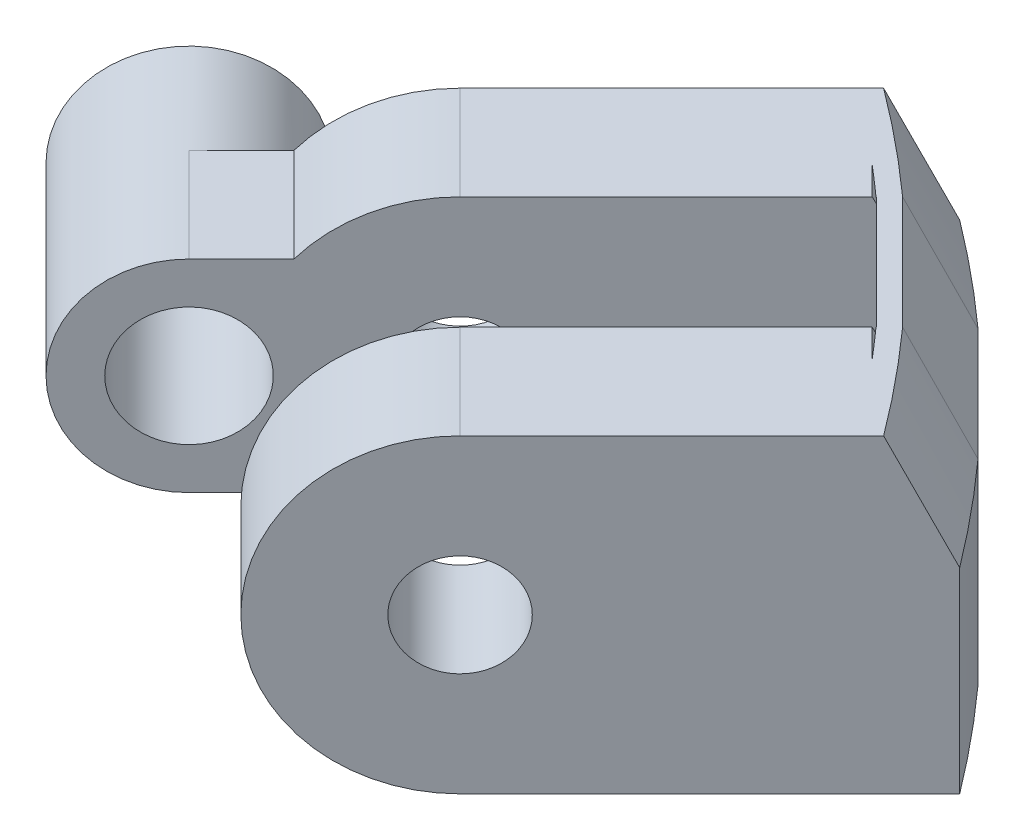
from build123d import *

# Parameters (mm, degrees)
SHELL1_T            = -0.8
SKETCH7_R           = 3
CUT_EXTRUDE3_DEPTH  = 186.253539274
BOSS_EXTRUDE1_DEPTH = 7.5
CUT_EXTRUDE4_DEPTH  = 1.75
CIRPATTERN1_COUNT   = 2
BOSS_EXTRUDE3_DEPTH = 10
CUT_EXTRUDE8_DEPTH  = 65.5
SKETCH17_R          = 0.75
BOSS_EXTRUDE4_DEPTH = 1.25
BOSS_EXTRUDE7_START = -6.25
BOSS_EXTRUDE7_DEPTH = 6.25
CUT_EXTRUDE9_REACH  = 192.044
SKETCH21_R          = 2.8
SKETCH22_R          = 4.75
SKETCH22_R_2        = 2.8
BOSS_EXTRUDE8_DEPTH = 4
SKETCH23_R          = 4.75
SKETCH23_R_2        = 2.3
BOSS_EXTRUDE9_DEPTH = 2
CIRPATTERN4_COUNT   = 4
BOSS_EXTRUDE6_REACH = 190.07
CIRPATTERN8_COUNT   = 4
CUT_EXTRUDE10_DEPTH = 172.733380907
CUT_EXTRUDE11_DEPTH = 120.808386396
CUT_EXTRUDE12_DEPTH = 96.01307774


with BuildPart() as part:
    # Sketch3 → Revolve1 (revolve)
    with BuildSketch(Plane.XY):
        with BuildLine():
            Line((0, 0), (0, 155.681963674))
            ThreePointArc((0, 155.681963674), (2.236067977, 155.154099629), (4, 153.681963674))
            Line((4, 153.681963674), (71, 10))
            Line((71, 10), (71, 0))
            Line((71, 0), (67.5, 0))
            Line((67.5, 0), (67.5, -50))
            Line((67.5, -50), (0, -50))
            Line((0, -50), (0, 0))
        make_face()
    revolve(axis=Axis((0, 0, 0), (0, 1, 0)))

    # Shell1
    shell1_openings = [part.faces().sort_by_distance(p)[0] for p in [
        (0, -50, 0),
    ]]
    offset(amount=SHELL1_T, openings=shell1_openings, kind=Kind.INTERSECTION)

    # Sketch7 → Cut-Extrude3 (cut, through all)
    with BuildSketch(Plane(origin=(0, 0, 0), x_dir=(1, 0, 0), z_dir=(0, 1, 0))):
        Circle(SKETCH7_R)
    extrude(amount=CUT_EXTRUDE3_DEPTH, mode=Mode.SUBTRACT)

    # Sketch8 → Boss-Extrude1 (add, symmetric)
    with BuildSketch(Plane(origin=(0, 0, 0), x_dir=(0, 0, -1), z_dir=(1, 0, 0))):
        Polygon((-39.806982196, 40.909925586), (-39.806982196, 35.909925586), (-44.806982196, 34.090074414), (-58.88391148, 34.090074414), (-44.806982196, 64.278146683), (-44.806982196, 44.090074414), (-44.806982196, 39.090074414), align=None)
    boss_extrude1 = extrude(amount=BOSS_EXTRUDE1_DEPTH, both=True)

    # Sketch9 → Cut-Extrude4 (cut, symmetric)
    with BuildSketch(Plane(origin=(0, 0, 0), x_dir=(0, 0, -1), z_dir=(1, 0, 0))):
        Polygon((-44.806982196, 39.090074414), (-44.806982196, 62.941354839), (-58.88391148, 34.090074414), (-44.806982196, 34.090074414), (-39.806982196, 35.909925586), (-39.806982196, 40.909925586), align=None)
    cut_extrude4 = extrude(amount=CUT_EXTRUDE4_DEPTH, both=True, mode=Mode.SUBTRACT)

    # CirPattern1: Boss-Extrude1, Cut-Extrude4 ×2 about axis
    cirpattern1_axis = Axis((0, 0, 0), (0, -1, 0))
    add([boss_extrude1.rotate(cirpattern1_axis, i * 360 / CIRPATTERN1_COUNT) for i in range(1, CIRPATTERN1_COUNT)])
    add([cut_extrude4.rotate(cirpattern1_axis, i * 360 / CIRPATTERN1_COUNT) for i in range(1, CIRPATTERN1_COUNT)], mode=Mode.SUBTRACT)

    # Sketch11 → Boss-Extrude3 (add, symmetric)
    with BuildSketch(Plane(origin=(0, 0, 0), x_dir=(0, -1, 0), z_dir=(0.707106781186552, 0, 0.7071067811865431))):
        with BuildLine():
            Line((-15.360916844, 53.7), (-15.360916844, 67.386877254))
            Line((-15.360916844, 67.386877254), (-9.82264427, 70.2))
            Line((-9.82264427, 70.2), (-0.8, 70.2))
            Line((-0.8, 70.2), (-0.8, 66.7))
            Line((-0.8, 66.7), (-0.8, 53.7))
            ThreePointArc((-0.8, 53.7), (-8.080458422, 46.419541578), (-15.360916844, 53.7))
        make_face()
    boss_extrude3 = extrude(amount=BOSS_EXTRUDE3_DEPTH, both=True)

    # Sketch13 → Cut-Extrude8 (cut)
    with BuildSketch(Plane.XZ.offset(50)):
        with BuildLine():
            Line((30.1719222, -35.475223059), (35.475223059, -30.1719222))
            Line((35.475223059, -30.1719222), (52.786157009, -47.48285615))
            ThreePointArc((52.786157009, -47.48285615), (50.204581464, -50.204581464), (47.48285615, -52.786157009))
            Line((47.48285615, -52.786157009), (30.1719222, -35.475223059))
        make_face()
    cut_extrude8 = extrude(amount=-CUT_EXTRUDE8_DEPTH, mode=Mode.SUBTRACT)

    # Sketch15 → M4 Clearance Hole1 (revolve, cut)
    with BuildSketch(Plane(origin=(45.042701962, 8.080458422, -30.900566338), x_dir=(0.7071067811865432, 0, -0.7071067811865519), z_dir=(0, 1, 0))):
        Polygon((0, 0), (0, 21.442065486), (2.4, 20), (2.4, 0), align=None)
    m4_clearance_hole1 = revolve(axis=Axis((49.532830022, 8.080458422, -26.410438277), (-0.7071067811865519, 0, -0.7071067811865432)), mode=Mode.SUBTRACT)

    # Sketch17 → Boss-Extrude4 (add, symmetric)
    with BuildSketch(Plane(origin=(0, 0, 0), x_dir=(0, -1, 0), z_dir=(0.707106781186552, 0, 0.7071067811865431))):
        with BuildLine():
            Line((-64.990829629, 44.47465268), (-52.181285177, 50.447841356))
            Line((-52.181285177, 50.447841356), (-50.912564437, 47.72706095))
            ThreePointArc((-50.912564437, 47.72706095), (-50.972988012, 46.343133558), (-52.141292504, 45.59884151))
            Line((-52.141292504, 45.59884151), (-64.990829629, 44.47465268))
        make_face()
        with Locations((-52.272026118, 47.093133558)):
            Circle(SKETCH17_R, mode=Mode.SUBTRACT)
    boss_extrude4 = extrude(amount=BOSS_EXTRUDE4_DEPTH, both=True)

    # Sketch19 → Boss-Extrude7 (add)
    with BuildSketch(Plane(origin=(-7.071067812, 0, -7.071067812), x_dir=(-0.7071067811865432, 0, 0.7071067811865519), z_dir=(-0.7071067811865519, 0, -0.7071067811865432)).offset(BOSS_EXTRUDE7_START)):
        with BuildLine():
            Line((-44.7, 12.830458422), (-48.182520971, 12.830458422))
            ThreePointArc((-48.182520971, 12.830458422), (-46.419541578, 8.080458422), (-48.182520971, 3.330458422))
            Line((-48.182520971, 3.330458422), (-44.7, 3.330458422))
            ThreePointArc((-44.7, 3.330458422), (-39.95, 8.080458422), (-44.7, 12.830458422))
        make_face()
    boss_extrude7 = extrude(amount=BOSS_EXTRUDE7_DEPTH)

    # Sketch21 → Cut-Extrude9 (cut, up to next)
    with BuildSketch(Plane(origin=(-7.071067812, 0, -7.071067812), x_dir=(-0.7071067811865432, 0, 0.7071067811865519), z_dir=(-0.7071067811865519, 0, -0.7071067811865432)), mode=Mode.PRIVATE) as cut_extrude9_sk1:
        with Locations((-44.7, 8.080458422)):
            Circle(SKETCH21_R)
    cut_extrude9_tool1 = extrude(cut_extrude9_sk1.sketch, amount=-CUT_EXTRUDE9_REACH, mode=Mode.PRIVATE) & part.part
    cut_extrude9 = cut_extrude9_tool1.solids().sort_by_distance((24.536605, 8.080458, -38.678741))[0]
    add(cut_extrude9, mode=Mode.SUBTRACT)

    # Sketch22 → Boss-Extrude8 (add)
    with BuildSketch(Plane(origin=(-7.071067812, 0, -7.071067812), x_dir=(-0.7071067811865432, 0, 0.7071067811865519), z_dir=(-0.7071067811865519, 0, -0.7071067811865432))):
        with Locations((-44.7, 8.080458422)):
            Circle(SKETCH22_R)
        with Locations((-44.7, 8.080458422)):
            Circle(SKETCH22_R_2, mode=Mode.SUBTRACT)
    boss_extrude8 = extrude(amount=BOSS_EXTRUDE8_DEPTH)

    # Sketch23 → Boss-Extrude9 (add)
    with BuildSketch(Plane(origin=(-9.899494937, 0, -9.899494937), x_dir=(-0.7071067811865434, 0, 0.7071067811865517), z_dir=(-0.7071067811865517, 0, -0.7071067811865434))):
        with Locations((-44.7, 8.080458422)):
            Circle(SKETCH23_R)
        with Locations((-44.7, 8.080458422)):
            Circle(SKETCH23_R_2, mode=Mode.SUBTRACT)
    boss_extrude9 = extrude(amount=BOSS_EXTRUDE9_DEPTH)

    # CirPattern4: Boss-Extrude3, Cut-Extrude8, M4 Clearance Hole1, Boss-Extrude4, Boss-Extrude7, Cut-Extrude9, Boss-Extrude8, Boss-Extrude9 ×4 about axis
    cirpattern4_axis = Axis((0, 0, 0), (0, -1, 0))
    add([boss_extrude3.rotate(cirpattern4_axis, i * 360 / CIRPATTERN4_COUNT) for i in range(1, CIRPATTERN4_COUNT)])
    add([cut_extrude8.rotate(cirpattern4_axis, i * 360 / CIRPATTERN4_COUNT) for i in range(1, CIRPATTERN4_COUNT)], mode=Mode.SUBTRACT)
    add([m4_clearance_hole1.rotate(cirpattern4_axis, i * 360 / CIRPATTERN4_COUNT) for i in range(1, CIRPATTERN4_COUNT)], mode=Mode.SUBTRACT)
    add([boss_extrude4.rotate(cirpattern4_axis, i * 360 / CIRPATTERN4_COUNT) for i in range(1, CIRPATTERN4_COUNT)])
    add([boss_extrude7.rotate(cirpattern4_axis, i * 360 / CIRPATTERN4_COUNT) for i in range(1, CIRPATTERN4_COUNT)])
    add([cut_extrude9.rotate(cirpattern4_axis, i * 360 / CIRPATTERN4_COUNT) for i in range(1, CIRPATTERN4_COUNT)], mode=Mode.SUBTRACT)
    add([boss_extrude8.rotate(cirpattern4_axis, i * 360 / CIRPATTERN4_COUNT) for i in range(1, CIRPATTERN4_COUNT)])
    add([boss_extrude9.rotate(cirpattern4_axis, i * 360 / CIRPATTERN4_COUNT) for i in range(1, CIRPATTERN4_COUNT)])

    # Sketch18 → Boss-Extrude6 (add, up to next)
    with BuildSketch(Plane(origin=(1.944543648, 0, -7.247844507), x_dir=(0.7071067811865437, 0, -0.7071067811865513), z_dir=(0.7071067811865513, 0, 0.7071067811865437)), mode=Mode.PRIVATE) as boss_extrude6_sk1:
        with BuildLine():
            Line((61.832487622, 15.5), (64.400899148, 10))
            Line((64.400899148, 10), (64.400899148, 7.805634816))
            Line((64.400899148, 7.805634816), (62.58432966, 9.97053803))
            ThreePointArc((62.58432966, 9.97053803), (62.166779573, 12.853725749), (60.948439685, 15.5))
            Line((60.948439685, 15.5), (61.832487622, 15.5))
        make_face()
    boss_extrude6_tool1 = extrude(boss_extrude6_sk1.sketch, amount=BOSS_EXTRUDE6_REACH, mode=Mode.PRIVATE) - part.part
    boss_extrude6 = boss_extrude6_tool1.solids().sort_by_distance((46.496587, 11.546485, -51.799888))[0]
    add(boss_extrude6)

    # CirPattern8: Boss-Extrude6 ×4 about axis
    cirpattern8_axis = Axis((0, 0, 0), (0, -1, 0))
    for i in range(1, CIRPATTERN8_COUNT):
        add(boss_extrude6.rotate(cirpattern8_axis, i * 360 / CIRPATTERN8_COUNT))

    # Sketch24 → Cut-Extrude10 (cut, through all)
    with BuildSketch(Plane(origin=(0, 15.360916844, 0), x_dir=(1, 0, 0), z_dir=(0, 1, 0))):
        with BuildLine():
            Line((47.48285615, 52.786157009), (52.786157009, 47.48285615))
            ThreePointArc((52.786157009, 47.48285615), (71, 0), (52.786157009, -47.48285615))
            Line((52.786157009, -47.48285615), (47.48285615, -52.786157009))
            ThreePointArc((47.48285615, -52.786157009), (0, -71), (-47.48285615, -52.786157009))
            Line((-47.48285615, -52.786157009), (-52.786157009, -47.48285615))
            ThreePointArc((-52.786157009, -47.48285615), (-71, 0), (-52.786157009, 47.48285615))
            Line((-52.786157009, 47.48285615), (-47.48285615, 52.786157009))
            ThreePointArc((-47.48285615, 52.786157009), (0, 71), (47.48285615, 52.786157009))
        make_face()
    extrude(amount=CUT_EXTRUDE10_DEPTH, mode=Mode.SUBTRACT)

    # Sketch25 → Cut-Extrude11 (cut, through all)
    with BuildSketch(Plane(origin=(0, 15.360916844, 0), x_dir=(1, 0, 0), z_dir=(0, 1, 0))):
        with BuildLine():
            Line((53.702012473, 39.559876849), (45.042701962, 30.900566338))
            Line((45.042701962, 30.900566338), (39.894640441, 25.752504817))
            Line((39.894640441, 25.752504817), (35.475223059, 30.1719222))
            Line((35.475223059, 30.1719222), (40.623284579, 35.31998372))
            Line((40.623284579, 35.31998372), (49.741073339, 44.437772481))
            Line((49.741073339, 44.437772481), (50.307644281, 45.004343422))
            Line((50.307644281, 45.004343422), (50.407545594, 45.104244735))
            Line((50.407545594, 45.104244735), (45.104244735, 50.407545594))
            Line((45.104244735, 50.407545594), (45.004343422, 50.307644281))
            Line((45.004343422, 50.307644281), (44.437772481, 49.741073339))
            Line((44.437772481, 49.741073339), (35.31998372, 40.623284579))
            Line((35.31998372, 40.623284579), (31.418536884, 36.721837743))
            Line((31.418536884, 36.721837743), (28.95602269, 34.259323548))
            Line((28.95602269, 34.259323548), (25.597265479, 30.900566338))
            Line((25.597265479, 30.900566338), (16.935207409, 39.562624407))
            Line((16.935207409, 39.562624407), (23.652721831, 46.280138829))
            Line((23.652721831, 46.280138829), (27.895362518, 42.037498142))
            Line((27.895362518, 42.037498142), (30.900566338, 45.042701962))
            Line((30.900566338, 45.042701962), (39.559876849, 53.702012473))
            Line((39.559876849, 53.702012473), (42.633056765, 56.775192389))
            ThreePointArc((42.633056765, 56.775192389), (-3.139783326, 70.930541804), (-47.48285615, 52.786157009))
            Line((-47.48285615, 52.786157009), (-52.786157009, 47.48285615))
            ThreePointArc((-52.786157009, 47.48285615), (-71, 0), (-52.786157009, -47.48285615))
            Line((-52.786157009, -47.48285615), (-47.48285615, -52.786157009))
            ThreePointArc((-47.48285615, -52.786157009), (0, -71), (47.48285615, -52.786157009))
            Line((47.48285615, -52.786157009), (52.786157009, -47.48285615))
            ThreePointArc((52.786157009, -47.48285615), (70.930541804, -3.139783326), (56.775192389, 42.633056765))
            Line((56.775192389, 42.633056765), (53.702012473, 39.559876849))
        make_face()
    extrude(amount=-CUT_EXTRUDE11_DEPTH, mode=Mode.SUBTRACT)

    # Sketch26 → Cut-Extrude12 (cut, through all)
    with BuildSketch(Plane.XZ.offset(-0.8)):
        with BuildLine():
            Line((50.301368299, -44.99806744), (40.623284579, -35.31998372))
            Line((40.623284579, -35.31998372), (35.475223059, -30.1719222))
            Line((35.475223059, -30.1719222), (39.894640441, -25.752504817))
            Line((39.894640441, -25.752504817), (45.042701962, -30.900566338))
            Line((45.042701962, -30.900566338), (54.989083154, -40.84694753))
            Line((54.989083154, -40.84694753), (56.775192389, -42.633056765))
            ThreePointArc((56.775192389, -42.633056765), (54.83431826, -45.10207912), (52.786157009, -47.48285615))
            Line((52.786157009, -47.48285615), (47.48285615, -52.786157009))
            ThreePointArc((47.48285615, -52.786157009), (45.10207912, -54.83431826), (42.633056765, -56.775192389))
            Line((42.633056765, -56.775192389), (40.84694753, -54.989083154))
            Line((40.84694753, -54.989083154), (30.900566338, -45.042701962))
            Line((30.900566338, -45.042701962), (27.895362518, -42.037498142))
            Line((27.895362518, -42.037498142), (23.652721831, -46.280138829))
            Line((23.652721831, -46.280138829), (16.935207409, -39.562624407))
            Line((16.935207409, -39.562624407), (25.597265479, -30.900566338))
            Line((25.597265479, -30.900566338), (28.95602269, -34.259323548))
            Line((28.95602269, -34.259323548), (31.418536884, -36.721837743))
            Line((31.418536884, -36.721837743), (35.31998372, -40.623284579))
            Line((35.31998372, -40.623284579), (44.99806744, -50.301368299))
            Line((44.99806744, -50.301368299), (45.087529202, -50.39083006))
            Line((45.087529202, -50.39083006), (45.104244735, -50.407545594))
            Line((45.104244735, -50.407545594), (50.407545594, -45.104244735))
            Line((50.407545594, -45.104244735), (50.39083006, -45.087529202))
            Line((50.39083006, -45.087529202), (50.301368299, -44.99806744))
        make_face()
    extrude(amount=CUT_EXTRUDE12_DEPTH, mode=Mode.SUBTRACT)


solid = part.part
